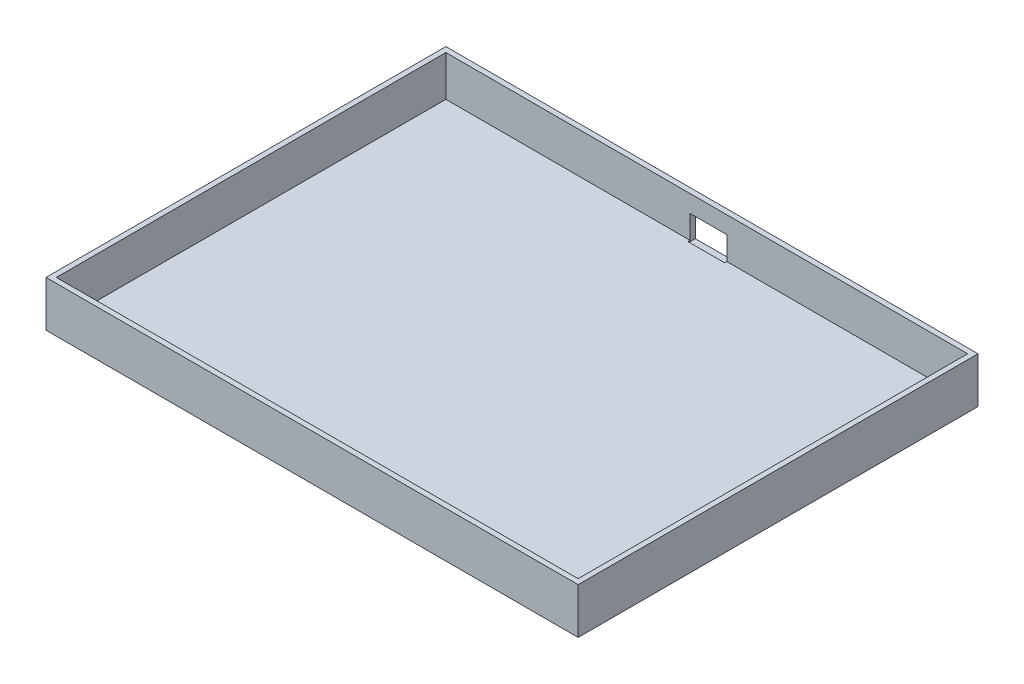
from build123d import *

# Parameters (mm, degrees)
SKETCH1_W           = 2615
SKETCH1_H           = 1965
BOSS_EXTRUDE1_DEPTH = 260
SHELL1_T            = 25.4
SKETCH2_W           = 2615
SKETCH2_H           = 1965
CUT_EXTRUDE1_DEPTH  = 35.306
SKETCH3_W           = 180
SKETCH3_H           = 120
CUT_EXTRUDE2_DEPTH  = 36


with BuildPart() as part:
    # Sketch1 → Boss-Extrude1 (new body)
    with BuildSketch(Plane(origin=(0, 0, 0), x_dir=(1, 0, 0), z_dir=(0, 1, 0))):
        Rectangle(SKETCH1_W, SKETCH1_H)
    extrude(amount=BOSS_EXTRUDE1_DEPTH)

    # Shell1 (no face opened: a closed hollow body)
    add(offset(amount=-SHELL1_T, mode=Mode.PRIVATE), mode=Mode.SUBTRACT)

    # Sketch2 → Cut-Extrude1 (cut)
    with BuildSketch(Plane(origin=(0, 260, 0), x_dir=(1, 0, 0), z_dir=(0, 1, 0))):
        Rectangle(SKETCH2_W, SKETCH2_H)
    extrude(amount=-CUT_EXTRUDE1_DEPTH, mode=Mode.SUBTRACT)

    # Sketch3 → Cut-Extrude2 (cut)
    with BuildSketch(Plane(origin=(0, 0, -982.5), x_dir=(-1, 0, 0), z_dir=(0, 0, -1))):
        with Locations((-8.350977114, 80)):
            Rectangle(SKETCH3_W, SKETCH3_H)
    extrude(amount=-CUT_EXTRUDE2_DEPTH, mode=Mode.SUBTRACT)


solid = part.part
